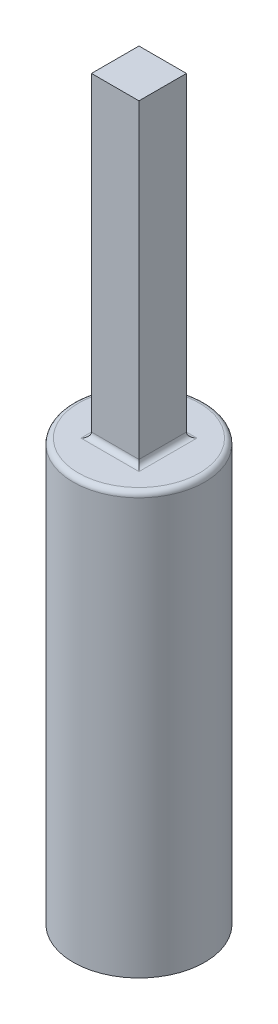
from build123d import *

# Parameters (mm, degrees)
SKETCH2_R           = 12.5
BOSS_EXTRUDE1_DEPTH = 80
SKETCH3_W           = 9.02
SKETCH3_H           = 9.02
BOSS_EXTRUDE2_DEPTH = 60
FILLET1_R           = 1
FILLET2_R           = 1


with BuildPart() as part:
    # Sketch2 → Boss-Extrude1 (new body)
    with BuildSketch(Plane(origin=(0, 0, 0), x_dir=(1, 0, 0), z_dir=(0, 1, 0))):
        Circle(SKETCH2_R)
    extrude(amount=BOSS_EXTRUDE1_DEPTH)

    # Sketch3 → Boss-Extrude2 (add)
    with BuildSketch(Plane(origin=(0, 80, 0), x_dir=(1, 0, 0), z_dir=(0, 1, 0))):
        Rectangle(SKETCH3_W, SKETCH3_H)
    extrude(amount=BOSS_EXTRUDE2_DEPTH)

    # Fillet1
    fillet1_edges = [part.edges().sort_by_distance(p)[0] for p in [
        (0, 80, -4.51),
        (4.51, 80, 0),
        (-4.51, 80, 0),
        (0, 80, 4.51),
    ]]
    fillet(fillet1_edges, radius=FILLET1_R)

    # Fillet2
    fillet2_edges = [part.edges().sort_by_distance(p)[0] for p in [
        (-12.5, 80, 0),
    ]]
    fillet(fillet2_edges, radius=FILLET2_R)


solid = part.part
